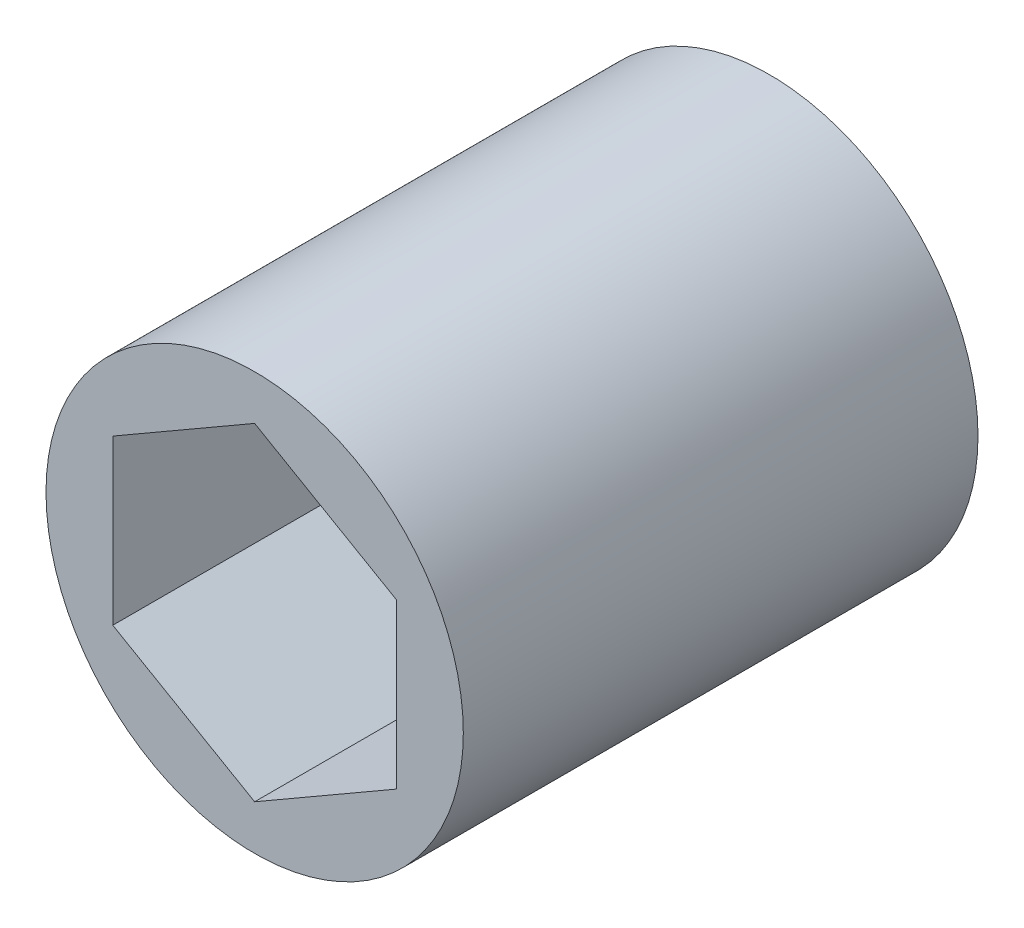
from build123d import *

# Parameters (mm, degrees)
SKETCH1_R           = 9.525
BOSS_EXTRUDE1_DEPTH = 11.7475


with BuildPart() as part:
    # Sketch1 → Boss-Extrude1 (new, symmetric)
    with BuildSketch(Plane.XY):
        Circle(SKETCH1_R)
        Polygon((0, 7.478995387), (-6.477, 3.739497694), (-6.477, -3.739497694), (0, -7.478995387), (6.477, -3.739497694), (6.477, 3.739497694), align=None, mode=Mode.SUBTRACT)
    extrude(amount=BOSS_EXTRUDE1_DEPTH, both=True)


solid = part.part
